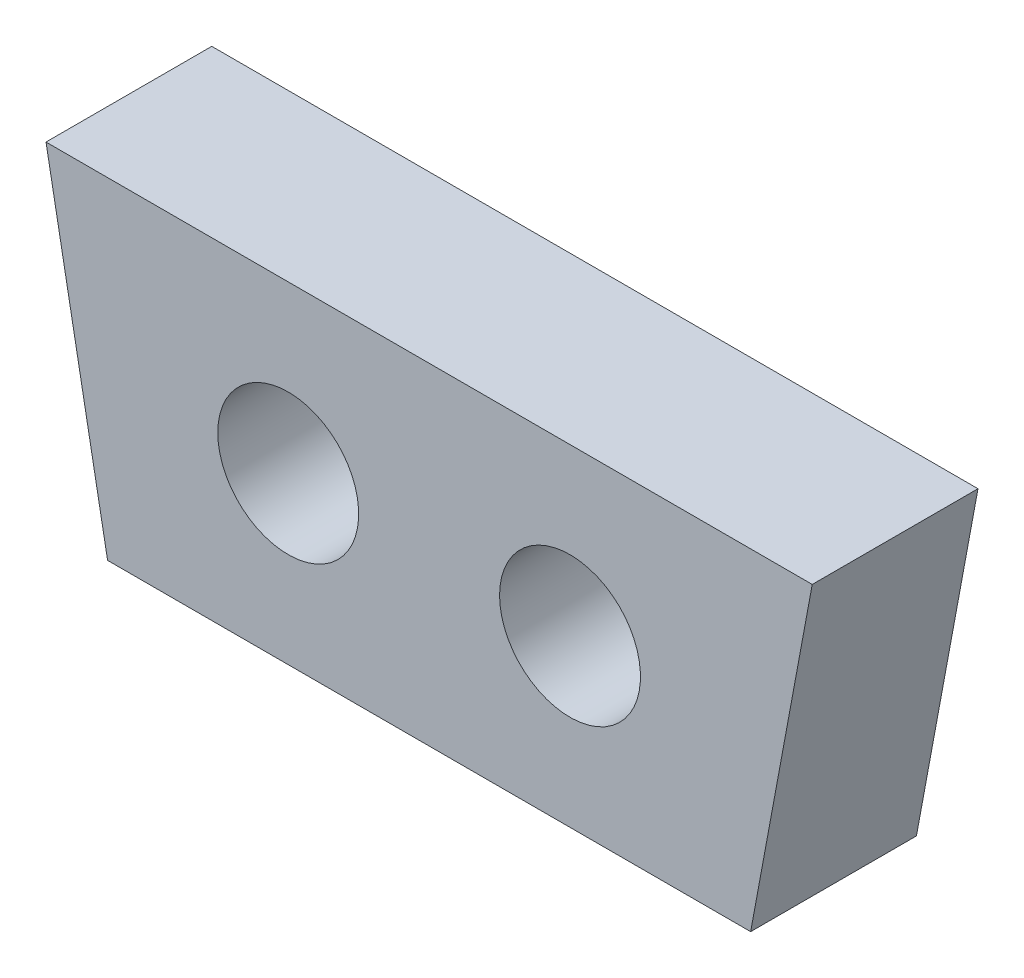
from build123d import *

# Parameters (mm, degrees)
BOSS_EXTRUDE1_DEPTH  = 4
M3_CLEARANCE_HOLE1_D = 3.4


with BuildPart() as part:
    # Sketch1 → Boss-Extrude1 (new body)
    with BuildSketch(Plane(origin=(0, 0, 0), x_dir=(1, 0, 0), z_dir=(0, 0, -1))):
        Polygon((7.758986606, 4), (-7.758986606, 4), (-9.245073547, -4), (9.245073547, -4), align=None)
    extrude(amount=BOSS_EXTRUDE1_DEPTH)

    # M3 Clearance Hole1 (through all)
    with Locations(Plane(origin=(0, 0, -4), x_dir=(-1, 0, 0), z_dir=(0, 0, -1))):
        with Locations((-3.4, 0), (3.4, 0)):
            Hole(M3_CLEARANCE_HOLE1_D / 2)


solid = part.part
